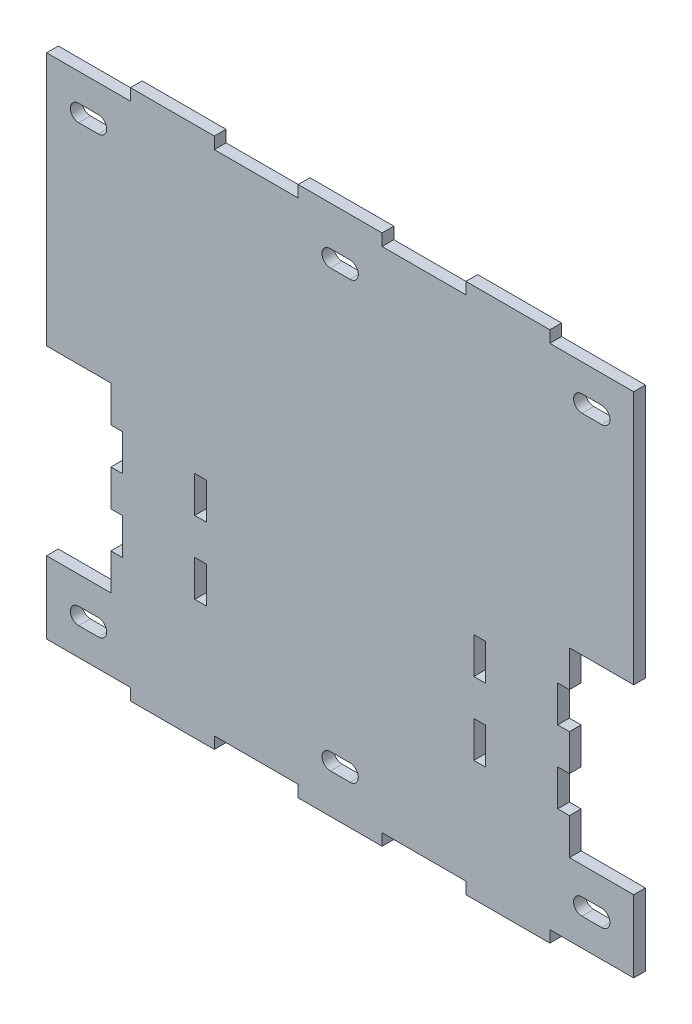
from build123d import *

# Parameters (mm, degrees)
SKETCH1_W           = 266.7
SKETCH1_H           = 241.3
BOSS_EXTRUDE1_DEPTH = 5.334
SKETCH2_W           = 29.21
SKETCH2_H           = 82.55
CUT_EXTRUDE1_DEPTH  = 180.908578328
SKETCH9_W           = 5.334
SKETCH9_H           = 16.51
CUT_EXTRUDE2_DEPTH  = 180.908578328
SKETCH23_W          = 5.334
SKETCH23_H          = 16.51
CUT_EXTRUDE8_DEPTH  = 180.908578328
SKETCH28_W          = 38.1
SKETCH28_H          = 5.334
CUT_EXTRUDE13_DEPTH = 180.908578328
SKETCH29_W          = 38.1
SKETCH29_H          = 5.334
CUT_EXTRUDE14_DEPTH = 180.908578328
CUT_EXTRUDE19_DEPTH = 180.908578328


with BuildPart() as part:
    # Sketch1 → Boss-Extrude1 (new body)
    with BuildSketch(Plane.XY):
        Rectangle(SKETCH1_W, SKETCH1_H)
    extrude(amount=BOSS_EXTRUDE1_DEPTH)

    # Sketch2 → Cut-Extrude1 (cut, through all)
    with BuildSketch(Plane(origin=(0, 0, 0), x_dir=(-1, 0, 0), z_dir=(0, 0, -1))):
        with Locations((118.745, -41.275)):
            Rectangle(SKETCH2_W, SKETCH2_H)
        with Locations((-118.745, -41.275)):
            Rectangle(SKETCH2_W, SKETCH2_H)
    extrude(amount=-CUT_EXTRUDE1_DEPTH, mode=Mode.SUBTRACT)

    # Sketch9 → Cut-Extrude2 (cut, through all)
    with BuildSketch(Plane.XY.offset(5.334)):
        with Locations((-101.473, -24.765)):
            Rectangle(SKETCH9_W, SKETCH9_H)
        with Locations((-101.473, -57.785)):
            Rectangle(SKETCH9_W, SKETCH9_H)
        with Locations((101.473, -57.785)):
            Rectangle(SKETCH9_W, SKETCH9_H)
        with Locations((101.473, -24.765)):
            Rectangle(SKETCH9_W, SKETCH9_H)
    extrude(amount=-CUT_EXTRUDE2_DEPTH, mode=Mode.SUBTRACT)

    # Sketch23 → Cut-Extrude8 (cut, through all)
    with BuildSketch(Plane.XY.offset(5.334)):
        with Locations((-63.373, -57.785)):
            Rectangle(SKETCH23_W, SKETCH23_H)
        with Locations((63.373, -24.765)):
            Rectangle(SKETCH23_W, SKETCH23_H)
        with Locations((63.373, -57.785)):
            Rectangle(SKETCH23_W, SKETCH23_H)
        with Locations((-63.373, -24.765)):
            Rectangle(SKETCH23_W, SKETCH23_H)
    extrude(amount=-CUT_EXTRUDE8_DEPTH, mode=Mode.SUBTRACT)

    # Sketch28 → Cut-Extrude13 (cut, through all)
    with BuildSketch(Plane(origin=(0, 0, 0), x_dir=(-1, 0, 0), z_dir=(0, 0, -1))):
        with Locations((-114.3, -117.983)):
            Rectangle(SKETCH28_W, SKETCH28_H)
        with Locations((-38.1, -117.983)):
            Rectangle(SKETCH28_W, SKETCH28_H)
        with Locations((38.1, -117.983)):
            Rectangle(SKETCH28_W, SKETCH28_H)
        with Locations((114.3, -117.983)):
            Rectangle(SKETCH28_W, SKETCH28_H)
    extrude(amount=-CUT_EXTRUDE13_DEPTH, mode=Mode.SUBTRACT)

    # Sketch29 → Cut-Extrude14 (cut, through all)
    with BuildSketch(Plane(origin=(0, 0, 0), x_dir=(-1, 0, 0), z_dir=(0, 0, -1))):
        with Locations((-114.3, 117.983)):
            Rectangle(SKETCH29_W, SKETCH29_H)
        with Locations((-38.1, 117.983)):
            Rectangle(SKETCH29_W, SKETCH29_H)
        with Locations((38.1, 117.983)):
            Rectangle(SKETCH29_W, SKETCH29_H)
        with Locations((114.3, 117.983)):
            Rectangle(SKETCH29_W, SKETCH29_H)
    extrude(amount=-CUT_EXTRUDE14_DEPTH, mode=Mode.SUBTRACT)

    # Sketch35 → Cut-Extrude19 (cut, through all)
    with BuildSketch(Plane.XY.offset(5.334)):
        with BuildLine():
            Line((-109.855, -102.743), (-118.745, -102.743))
            ThreePointArc((-118.745, -102.743), (-122.555, -98.933), (-118.745, -95.123))
            Line((-118.745, -95.123), (-109.855, -95.123))
            ThreePointArc((-109.855, -95.123), (-106.045, -98.933), (-109.855, -102.743))
        make_face()
        with BuildLine():
            Line((109.855, -95.123), (118.745, -95.123))
            ThreePointArc((118.745, -95.123), (122.555, -98.933), (118.745, -102.743))
            Line((118.745, -102.743), (109.855, -102.743))
            ThreePointArc((109.855, -102.743), (106.045, -98.933), (109.855, -95.123))
        make_face()
        with BuildLine():
            Line((109.855, 95.123), (118.745, 95.123))
            ThreePointArc((118.745, 95.123), (122.555, 98.933), (118.745, 102.743))
            Line((118.745, 102.743), (109.855, 102.743))
            ThreePointArc((109.855, 102.743), (106.045, 98.933), (109.855, 95.123))
        make_face()
        with BuildLine():
            Line((-109.855, 102.743), (-118.745, 102.743))
            ThreePointArc((-118.745, 102.743), (-122.555, 98.933), (-118.745, 95.123))
            Line((-118.745, 95.123), (-109.855, 95.123))
            ThreePointArc((-109.855, 95.123), (-106.045, 98.933), (-109.855, 102.743))
        make_face()
        with BuildLine():
            Line((4.445, 102.743), (-4.445, 102.743))
            ThreePointArc((-4.445, 102.743), (-8.255, 98.933), (-4.445, 95.123))
            Line((-4.445, 95.123), (4.445, 95.123))
            ThreePointArc((4.445, 95.123), (8.255, 98.933), (4.445, 102.743))
        make_face()
        with BuildLine():
            Line((4.445, -102.743), (-4.445, -102.743))
            ThreePointArc((-4.445, -102.743), (-8.255, -98.933), (-4.445, -95.123))
            Line((-4.445, -95.123), (4.445, -95.123))
            ThreePointArc((4.445, -95.123), (8.255, -98.933), (4.445, -102.743))
        make_face()
    extrude(amount=-CUT_EXTRUDE19_DEPTH, mode=Mode.SUBTRACT)


solid = part.part
